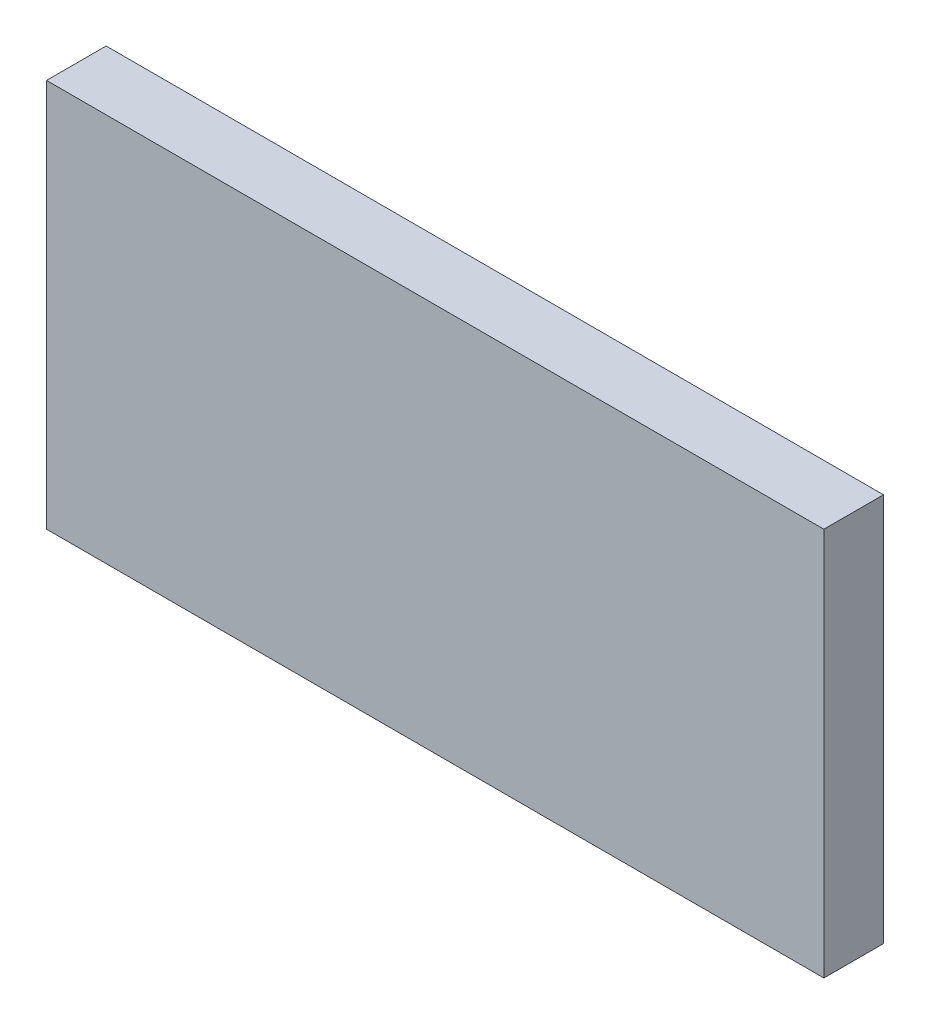
from build123d import *

# Parameters (mm, degrees)
SKETCH1_W           = 38.1
SKETCH1_H           = 19.05
BOSS_EXTRUDE1_DEPTH = 2.921


with BuildPart() as part:
    # Sketch1 → Boss-Extrude1 (new body)
    with BuildSketch(Plane.XY):
        with Locations((19.05, 9.525)):
            Rectangle(SKETCH1_W, SKETCH1_H)
    extrude(amount=-BOSS_EXTRUDE1_DEPTH)


solid = part.part
